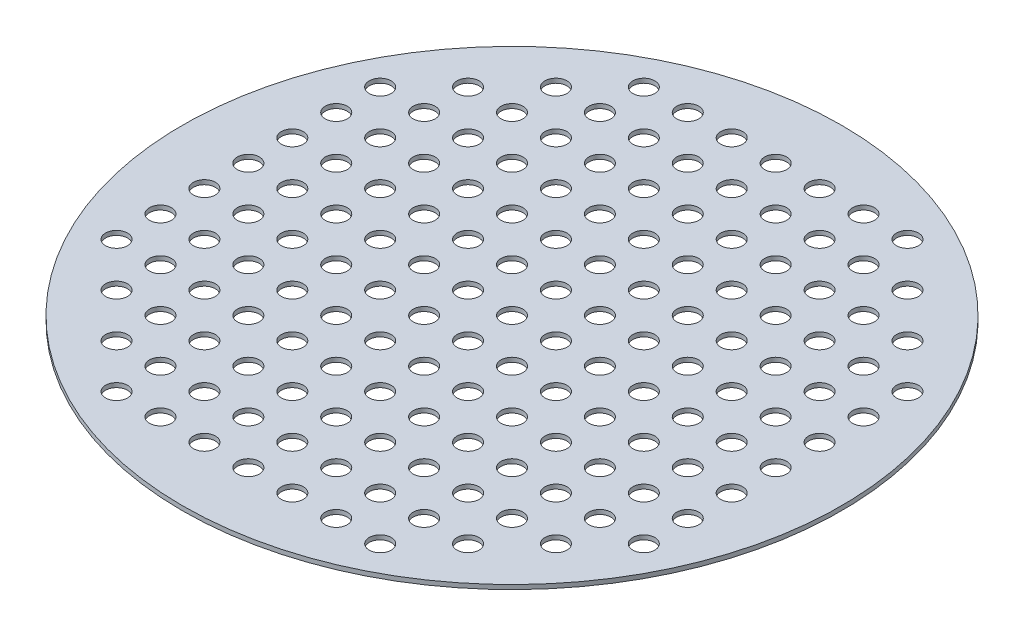
from build123d import *

# Parameters (mm, degrees)
SKETCH2_R               = 7.5
BOSS_EXTRUDE1_DEPTH     = 0.1
SKETCH4_R               = 0.25
CUT_EXTRUDE1_DEPTH      = 11.607073112
FILL_PATTERN1_OUTLINE_R = 0.25
FILL_PATTERN1_DEPTH     = 0.1


# Read off the part's stored shape, not the designer's step: Fill Pattern1
with BuildPart() as part:
    # Sketch2 → Boss-Extrude1 (new body)
    with BuildSketch(Plane(origin=(0, 0, 0), x_dir=(1, 0, 0), z_dir=(0, 1, 0))):
        with Locations(Location((0, 0, 0), (0, 0, 270))):
            Circle(SKETCH2_R)
    extrude(amount=BOSS_EXTRUDE1_DEPTH)

    # Sketch4 → Cut-Extrude1 (cut, through all)
    with BuildSketch(Plane(origin=(0, 0.1, 0), x_dir=(1, 0, 0), z_dir=(0, 1, 0))):
        with Locations(Location((0, 0, 0), (0, 0, 270))):
            Circle(SKETCH4_R)
    extrude(amount=-CUT_EXTRUDE1_DEPTH, mode=Mode.SUBTRACT)

    # Fill Pattern1 outline → Fill Pattern1 (cut)
    with BuildSketch(Plane(origin=(0, 0, 0), x_dir=(1, 0, 0), z_dir=(0, 1, 0))):
        with Locations((1, -1)):
            Circle(FILL_PATTERN1_OUTLINE_R)
        with Locations((-3, 3)):
            Circle(FILL_PATTERN1_OUTLINE_R)
        with Locations((-2, 3)):
            Circle(FILL_PATTERN1_OUTLINE_R)
        with Locations((-1, 3)):
            Circle(FILL_PATTERN1_OUTLINE_R)
        with Locations((0, 3)):
            Circle(FILL_PATTERN1_OUTLINE_R)
        with Locations((1, 3)):
            Circle(FILL_PATTERN1_OUTLINE_R)
        with Locations((2, 3)):
            Circle(FILL_PATTERN1_OUTLINE_R)
        with Locations((3, 3)):
            Circle(FILL_PATTERN1_OUTLINE_R)
        with Locations((3, 2)):
            Circle(FILL_PATTERN1_OUTLINE_R)
        with Locations((3, 1)):
            Circle(FILL_PATTERN1_OUTLINE_R)
        with Locations((-1, -4)):
            Circle(FILL_PATTERN1_OUTLINE_R)
        with Locations((0, -4)):
            Circle(FILL_PATTERN1_OUTLINE_R)
        with Locations((1, -4)):
            Circle(FILL_PATTERN1_OUTLINE_R)
        with Locations((2, -4)):
            Circle(FILL_PATTERN1_OUTLINE_R)
        with Locations((3, -4)):
            Circle(FILL_PATTERN1_OUTLINE_R)
        with Locations((4, -4)):
            Circle(FILL_PATTERN1_OUTLINE_R)
        with Locations((3, -2)):
            Circle(FILL_PATTERN1_OUTLINE_R)
        with Locations((3, -1)):
            Circle(FILL_PATTERN1_OUTLINE_R)
        with Locations((3, 0)):
            Circle(FILL_PATTERN1_OUTLINE_R)
        with Locations((-2, -4)):
            Circle(FILL_PATTERN1_OUTLINE_R)
        with Locations((-3, -4)):
            Circle(FILL_PATTERN1_OUTLINE_R)
        with Locations((-4, -4)):
            Circle(FILL_PATTERN1_OUTLINE_R)
        with Locations((-4, -3)):
            Circle(FILL_PATTERN1_OUTLINE_R)
        with Locations((-4, -2)):
            Circle(FILL_PATTERN1_OUTLINE_R)
        with Locations((-4, -1)):
            Circle(FILL_PATTERN1_OUTLINE_R)
        with Locations((-4, 0)):
            Circle(FILL_PATTERN1_OUTLINE_R)
        with Locations((-4, 1)):
            Circle(FILL_PATTERN1_OUTLINE_R)
        with Locations((-4, 2)):
            Circle(FILL_PATTERN1_OUTLINE_R)
        with Locations((-4, 3)):
            Circle(FILL_PATTERN1_OUTLINE_R)
        with Locations((-4, 4)):
            Circle(FILL_PATTERN1_OUTLINE_R)
        with Locations((-3, 4)):
            Circle(FILL_PATTERN1_OUTLINE_R)
        with Locations((-2, 4)):
            Circle(FILL_PATTERN1_OUTLINE_R)
        with Locations((-1, 4)):
            Circle(FILL_PATTERN1_OUTLINE_R)
        with Locations((0, 4)):
            Circle(FILL_PATTERN1_OUTLINE_R)
        with Locations((1, 4)):
            Circle(FILL_PATTERN1_OUTLINE_R)
        with Locations((2, 4)):
            Circle(FILL_PATTERN1_OUTLINE_R)
        with Locations((3, 4)):
            Circle(FILL_PATTERN1_OUTLINE_R)
        with Locations((-1, 2)):
            Circle(FILL_PATTERN1_OUTLINE_R)
        with Locations((-2, 2)):
            Circle(FILL_PATTERN1_OUTLINE_R)
        with Locations((-2, 1)):
            Circle(FILL_PATTERN1_OUTLINE_R)
        with Locations((-2, 0)):
            Circle(FILL_PATTERN1_OUTLINE_R)
        with Locations((-2, -1)):
            Circle(FILL_PATTERN1_OUTLINE_R)
        with Locations((-2, -2)):
            Circle(FILL_PATTERN1_OUTLINE_R)
        with Locations((-1, -2)):
            Circle(FILL_PATTERN1_OUTLINE_R)
        with Locations((0, -2)):
            Circle(FILL_PATTERN1_OUTLINE_R)
        with Locations((1, -2)):
            Circle(FILL_PATTERN1_OUTLINE_R)
        with Locations((0, -1)):
            Circle(FILL_PATTERN1_OUTLINE_R)
        with Locations((-1, -1)):
            Circle(FILL_PATTERN1_OUTLINE_R)
        with Locations((-1, 0)):
            Circle(FILL_PATTERN1_OUTLINE_R)
        with Locations((-1, 1)):
            Circle(FILL_PATTERN1_OUTLINE_R)
        with Locations((0, 1)):
            Circle(FILL_PATTERN1_OUTLINE_R)
        with Locations((1, 1)):
            Circle(FILL_PATTERN1_OUTLINE_R)
        with Locations((1, 0)):
            Circle(FILL_PATTERN1_OUTLINE_R)
        with Locations((2, -2)):
            Circle(FILL_PATTERN1_OUTLINE_R)
        with Locations((-3, 2)):
            Circle(FILL_PATTERN1_OUTLINE_R)
        with Locations((-3, 1)):
            Circle(FILL_PATTERN1_OUTLINE_R)
        with Locations((-3, 0)):
            Circle(FILL_PATTERN1_OUTLINE_R)
        with Locations((-3, -1)):
            Circle(FILL_PATTERN1_OUTLINE_R)
        with Locations((-3, -2)):
            Circle(FILL_PATTERN1_OUTLINE_R)
        with Locations((-3, -3)):
            Circle(FILL_PATTERN1_OUTLINE_R)
        with Locations((-2, -3)):
            Circle(FILL_PATTERN1_OUTLINE_R)
        with Locations((-1, -3)):
            Circle(FILL_PATTERN1_OUTLINE_R)
        with Locations((0, -3)):
            Circle(FILL_PATTERN1_OUTLINE_R)
        with Locations((1, -3)):
            Circle(FILL_PATTERN1_OUTLINE_R)
        with Locations((2, -3)):
            Circle(FILL_PATTERN1_OUTLINE_R)
        with Locations((3, -3)):
            Circle(FILL_PATTERN1_OUTLINE_R)
        with Locations((2, -1)):
            Circle(FILL_PATTERN1_OUTLINE_R)
        with Locations((2, 0)):
            Circle(FILL_PATTERN1_OUTLINE_R)
        with Locations((2, 1)):
            Circle(FILL_PATTERN1_OUTLINE_R)
        with Locations((2, 2)):
            Circle(FILL_PATTERN1_OUTLINE_R)
        with Locations((1, 2)):
            Circle(FILL_PATTERN1_OUTLINE_R)
        with Locations((0, 2)):
            Circle(FILL_PATTERN1_OUTLINE_R)
        with Locations((5, 3)):
            Circle(FILL_PATTERN1_OUTLINE_R)
        with Locations((5, 2)):
            Circle(FILL_PATTERN1_OUTLINE_R)
        with Locations((5, 1)):
            Circle(FILL_PATTERN1_OUTLINE_R)
        with Locations((5, 0)):
            Circle(FILL_PATTERN1_OUTLINE_R)
        with Locations((5, -1)):
            Circle(FILL_PATTERN1_OUTLINE_R)
        with Locations((5, -2)):
            Circle(FILL_PATTERN1_OUTLINE_R)
        with Locations((5, -3)):
            Circle(FILL_PATTERN1_OUTLINE_R)
        with Locations((5, -4)):
            Circle(FILL_PATTERN1_OUTLINE_R)
        with Locations((3, -6)):
            Circle(FILL_PATTERN1_OUTLINE_R)
        with Locations((2, -6)):
            Circle(FILL_PATTERN1_OUTLINE_R)
        with Locations((1, -6)):
            Circle(FILL_PATTERN1_OUTLINE_R)
        with Locations((0, -6)):
            Circle(FILL_PATTERN1_OUTLINE_R)
        with Locations((-1, -6)):
            Circle(FILL_PATTERN1_OUTLINE_R)
        with Locations((-2, -6)):
            Circle(FILL_PATTERN1_OUTLINE_R)
        with Locations((-3, -6)):
            Circle(FILL_PATTERN1_OUTLINE_R)
        with Locations((-6, -3)):
            Circle(FILL_PATTERN1_OUTLINE_R)
        with Locations((-6, -2)):
            Circle(FILL_PATTERN1_OUTLINE_R)
        with Locations((-6, -1)):
            Circle(FILL_PATTERN1_OUTLINE_R)
        with Locations((-6, 0)):
            Circle(FILL_PATTERN1_OUTLINE_R)
        with Locations((-6, 1)):
            Circle(FILL_PATTERN1_OUTLINE_R)
        with Locations((-6, 2)):
            Circle(FILL_PATTERN1_OUTLINE_R)
        with Locations((-6, 3)):
            Circle(FILL_PATTERN1_OUTLINE_R)
        with Locations((-3, 6)):
            Circle(FILL_PATTERN1_OUTLINE_R)
        with Locations((-2, 6)):
            Circle(FILL_PATTERN1_OUTLINE_R)
        with Locations((-1, 6)):
            Circle(FILL_PATTERN1_OUTLINE_R)
        with Locations((0, 6)):
            Circle(FILL_PATTERN1_OUTLINE_R)
        with Locations((1, 6)):
            Circle(FILL_PATTERN1_OUTLINE_R)
        with Locations((2, 6)):
            Circle(FILL_PATTERN1_OUTLINE_R)
        with Locations((3, 6)):
            Circle(FILL_PATTERN1_OUTLINE_R)
        with Locations((6, 3)):
            Circle(FILL_PATTERN1_OUTLINE_R)
        with Locations((6, 2)):
            Circle(FILL_PATTERN1_OUTLINE_R)
        with Locations((6, 1)):
            Circle(FILL_PATTERN1_OUTLINE_R)
        with Locations((6, 0)):
            Circle(FILL_PATTERN1_OUTLINE_R)
        with Locations((6, -1)):
            Circle(FILL_PATTERN1_OUTLINE_R)
        with Locations((6, -2)):
            Circle(FILL_PATTERN1_OUTLINE_R)
        with Locations((6, -3)):
            Circle(FILL_PATTERN1_OUTLINE_R)
        with Locations((4, 4)):
            Circle(FILL_PATTERN1_OUTLINE_R)
        with Locations((4, 3)):
            Circle(FILL_PATTERN1_OUTLINE_R)
        with Locations((4, 2)):
            Circle(FILL_PATTERN1_OUTLINE_R)
        with Locations((4, 1)):
            Circle(FILL_PATTERN1_OUTLINE_R)
        with Locations((4, 0)):
            Circle(FILL_PATTERN1_OUTLINE_R)
        with Locations((4, -1)):
            Circle(FILL_PATTERN1_OUTLINE_R)
        with Locations((4, -2)):
            Circle(FILL_PATTERN1_OUTLINE_R)
        with Locations((4, -3)):
            Circle(FILL_PATTERN1_OUTLINE_R)
        with Locations((4, -5)):
            Circle(FILL_PATTERN1_OUTLINE_R)
        with Locations((3, -5)):
            Circle(FILL_PATTERN1_OUTLINE_R)
        with Locations((2, -5)):
            Circle(FILL_PATTERN1_OUTLINE_R)
        with Locations((1, -5)):
            Circle(FILL_PATTERN1_OUTLINE_R)
        with Locations((0, -5)):
            Circle(FILL_PATTERN1_OUTLINE_R)
        with Locations((-1, -5)):
            Circle(FILL_PATTERN1_OUTLINE_R)
        with Locations((-2, -5)):
            Circle(FILL_PATTERN1_OUTLINE_R)
        with Locations((-3, -5)):
            Circle(FILL_PATTERN1_OUTLINE_R)
        with Locations((-4, -5)):
            Circle(FILL_PATTERN1_OUTLINE_R)
        with Locations((-5, -4)):
            Circle(FILL_PATTERN1_OUTLINE_R)
        with Locations((-5, -3)):
            Circle(FILL_PATTERN1_OUTLINE_R)
        with Locations((-5, -2)):
            Circle(FILL_PATTERN1_OUTLINE_R)
        with Locations((-5, -1)):
            Circle(FILL_PATTERN1_OUTLINE_R)
        with Locations((-5, 0)):
            Circle(FILL_PATTERN1_OUTLINE_R)
        with Locations((-5, 1)):
            Circle(FILL_PATTERN1_OUTLINE_R)
        with Locations((-5, 2)):
            Circle(FILL_PATTERN1_OUTLINE_R)
        with Locations((-5, 3)):
            Circle(FILL_PATTERN1_OUTLINE_R)
        with Locations((-5, 4)):
            Circle(FILL_PATTERN1_OUTLINE_R)
        with Locations((-4, 5)):
            Circle(FILL_PATTERN1_OUTLINE_R)
        with Locations((-3, 5)):
            Circle(FILL_PATTERN1_OUTLINE_R)
        with Locations((-2, 5)):
            Circle(FILL_PATTERN1_OUTLINE_R)
        with Locations((-1, 5)):
            Circle(FILL_PATTERN1_OUTLINE_R)
        with Locations((0, 5)):
            Circle(FILL_PATTERN1_OUTLINE_R)
        with Locations((1, 5)):
            Circle(FILL_PATTERN1_OUTLINE_R)
        with Locations((2, 5)):
            Circle(FILL_PATTERN1_OUTLINE_R)
        with Locations((3, 5)):
            Circle(FILL_PATTERN1_OUTLINE_R)
        with Locations((4, 5)):
            Circle(FILL_PATTERN1_OUTLINE_R)
        with Locations((5, 4)):
            Circle(FILL_PATTERN1_OUTLINE_R)
    extrude(amount=FILL_PATTERN1_DEPTH, mode=Mode.SUBTRACT)


solid = part.part
